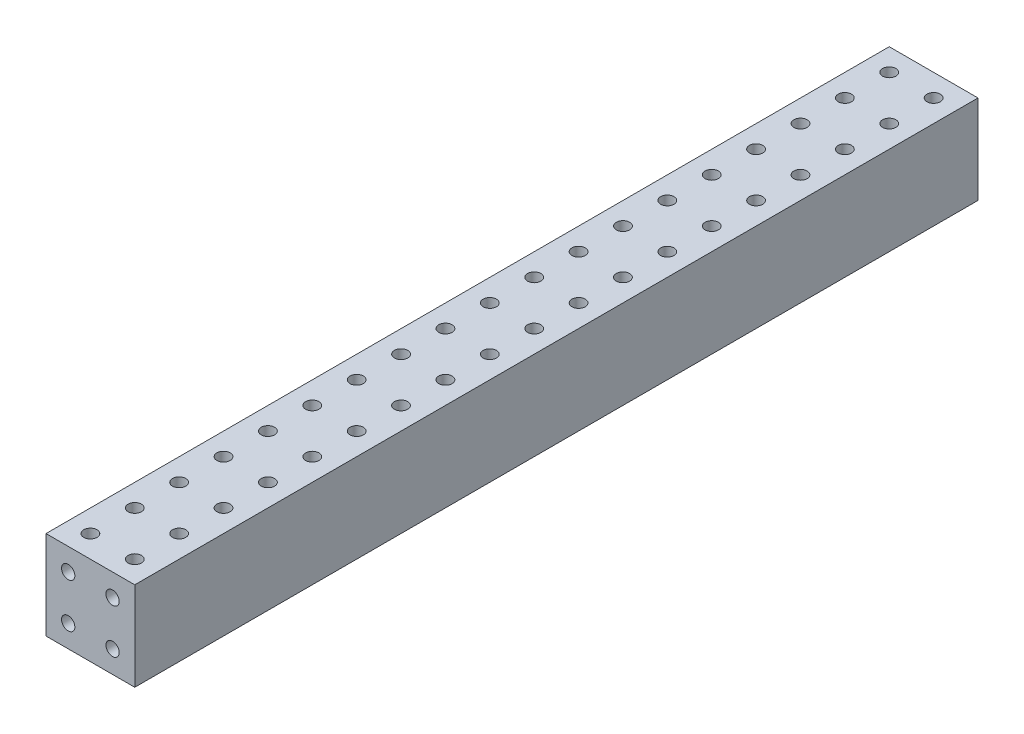
from build123d import *

# Parameters (mm, degrees)
SKETCH1_W           = 20
SKETCH1_H           = 20
BOSS_EXTRUDE1_DEPTH = 190
SKETCH2_R           = 1.5
CUT_EXTRUDE2_DEPTH  = 20
SKETCH3_R           = 1.5
CUT_EXTRUDE3_DEPTH  = 10


with BuildPart() as part:
    # Sketch1 → Boss-Extrude1 (new body)
    with BuildSketch(Plane.XY):
        with Locations((10, 10)):
            Rectangle(SKETCH1_W, SKETCH1_H)
    extrude(amount=BOSS_EXTRUDE1_DEPTH)

    # Sketch2 → Cut-Extrude2 (cut)
    with BuildSketch(Plane(origin=(0, 20, 0), x_dir=(1, 0, 0), z_dir=(0, 1, 0))):
        with Locations((15, -185)):
            Circle(SKETCH2_R)
        with Locations((15, -175)):
            Circle(SKETCH2_R)
        with Locations((15, -165)):
            Circle(SKETCH2_R)
        with Locations((15, -155)):
            Circle(SKETCH2_R)
        with Locations((15, -145)):
            Circle(SKETCH2_R)
        with Locations((15, -135)):
            Circle(SKETCH2_R)
        with Locations((15, -125)):
            Circle(SKETCH2_R)
        with Locations((15, -115)):
            Circle(SKETCH2_R)
        with Locations((15, -105)):
            Circle(SKETCH2_R)
        with Locations((15, -95)):
            Circle(SKETCH2_R)
        with Locations((15, -85)):
            Circle(SKETCH2_R)
        with Locations((15, -75)):
            Circle(SKETCH2_R)
        with Locations((15, -65)):
            Circle(SKETCH2_R)
        with Locations((15, -55)):
            Circle(SKETCH2_R)
        with Locations((15, -45)):
            Circle(SKETCH2_R)
        with Locations((15, -35)):
            Circle(SKETCH2_R)
        with Locations((15, -25)):
            Circle(SKETCH2_R)
        with Locations((15, -15)):
            Circle(SKETCH2_R)
        with Locations((15, -5)):
            Circle(SKETCH2_R)
        with Locations((5, -5)):
            Circle(SKETCH2_R)
        with Locations((5, -15)):
            Circle(SKETCH2_R)
        with Locations((5, -25)):
            Circle(SKETCH2_R)
        with Locations((5, -35)):
            Circle(SKETCH2_R)
        with Locations((5, -45)):
            Circle(SKETCH2_R)
        with Locations((5, -55)):
            Circle(SKETCH2_R)
        with Locations((5, -65)):
            Circle(SKETCH2_R)
        with Locations((5, -75)):
            Circle(SKETCH2_R)
        with Locations((5, -85)):
            Circle(SKETCH2_R)
        with Locations((5, -95)):
            Circle(SKETCH2_R)
        with Locations((5, -105)):
            Circle(SKETCH2_R)
        with Locations((5, -115)):
            Circle(SKETCH2_R)
        with Locations((5, -125)):
            Circle(SKETCH2_R)
        with Locations((5, -135)):
            Circle(SKETCH2_R)
        with Locations((5, -145)):
            Circle(SKETCH2_R)
        with Locations((5, -155)):
            Circle(SKETCH2_R)
        with Locations((5, -165)):
            Circle(SKETCH2_R)
        with Locations((5, -175)):
            Circle(SKETCH2_R)
        with Locations((5, -185)):
            Circle(SKETCH2_R)
    extrude(amount=-CUT_EXTRUDE2_DEPTH, mode=Mode.SUBTRACT)

    # Sketch3 → Cut-Extrude3 (cut)
    with BuildSketch(Plane.XY.offset(190)):
        with Locations((15, 15)):
            Circle(SKETCH3_R)
        with Locations((15, 5)):
            Circle(SKETCH3_R)
        with Locations((5, 5)):
            Circle(SKETCH3_R)
        with Locations((5, 15)):
            Circle(SKETCH3_R)
    extrude(amount=-CUT_EXTRUDE3_DEPTH, mode=Mode.SUBTRACT)


solid = part.part
